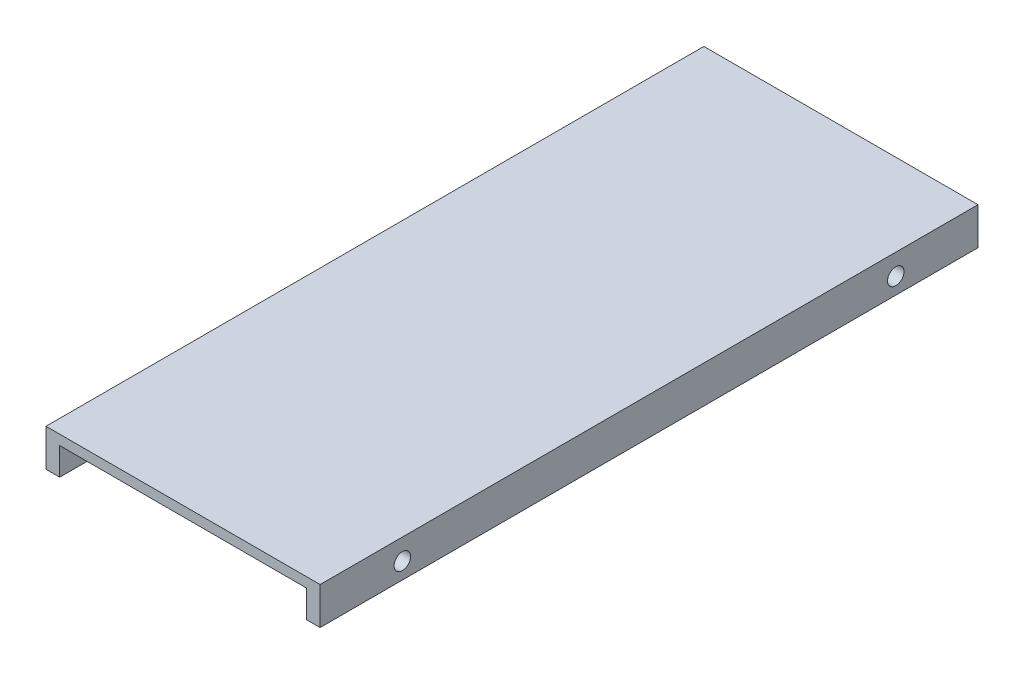
from build123d import *

# Parameters (mm, degrees)
BOSS_EXTRUDE1_DEPTH = 1200
SKETCH2_R           = 15
CUT_EXTRUDE1_DEPTH  = 1200
SKETCH4_R           = 15
CUT_EXTRUDE2_DEPTH  = 1200


with BuildPart() as part:
    # Sketch1 → Boss-Extrude1 (new body)
    with BuildSketch(Plane.XY):
        Polygon((0, 0), (25, 0), (25, 50), (475, 50), (475, 0), (500, 0), (500, 68), (0, 68), align=None)
    extrude(amount=BOSS_EXTRUDE1_DEPTH)

    # Sketch2 → Cut-Extrude1 (cut)
    with BuildSketch(Plane(origin=(500, 0, 0), x_dir=(0, 0, -1), z_dir=(1, 0, 0))):
        with Locations((-1050, 30)):
            Circle(SKETCH2_R)
    extrude(amount=-CUT_EXTRUDE1_DEPTH, mode=Mode.SUBTRACT)

    # Sketch4 → Cut-Extrude2 (cut)
    with BuildSketch(Plane(origin=(500, 0, 0), x_dir=(0, 0, -1), z_dir=(1, 0, 0))):
        with Locations((-150, 30)):
            Circle(SKETCH4_R)
    extrude(amount=-CUT_EXTRUDE2_DEPTH, mode=Mode.SUBTRACT)


solid = part.part
